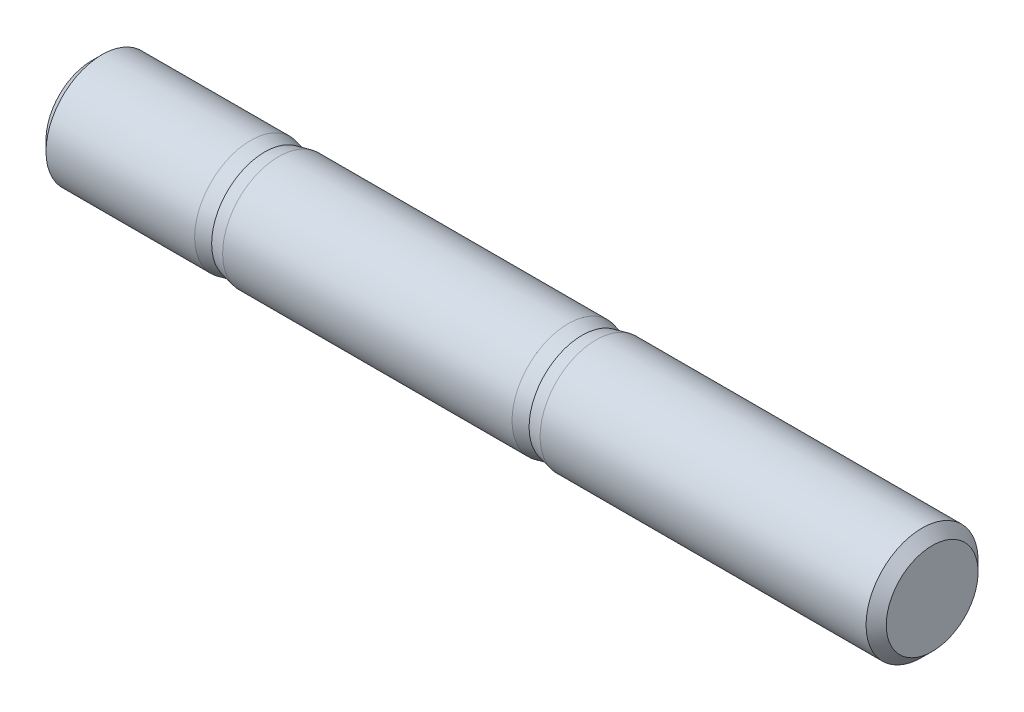
from build123d import *

# Parameters (mm, degrees)
HEADCHAMFER_SIZE = 0.5415


with BuildPart() as part:
    # Sketch1 → BaseHead (revolve)
    with BuildSketch(Plane.XY):
        Polygon((0, 0), (0, 3), (8.5, 3), (10, 2.675), (25.5, 2.675), (27, 3), (45, 3), (45, 0), align=None)
    revolve(axis=Axis((-1.310841664, 0, 0), (1, 0, 0)))

    # HeadChamfer
    headchamfer_edges = [part.edges().sort_by_distance(p)[0] for p in [
        (0, -3, 0),
        (45, -3, 0),
    ]]
    chamfer(headchamfer_edges, length=HEADCHAMFER_SIZE)

    # Sketch2 → BaseBody (revolve)
    with BuildSketch(Plane.XY):
        Polygon((8.5, 2.675), (10, 3), (25.5, 3), (27, 2.675), align=None)
    revolve(axis=Axis((-1.310841664, 0, 0), (1, 0, 0)))


solid = part.part
